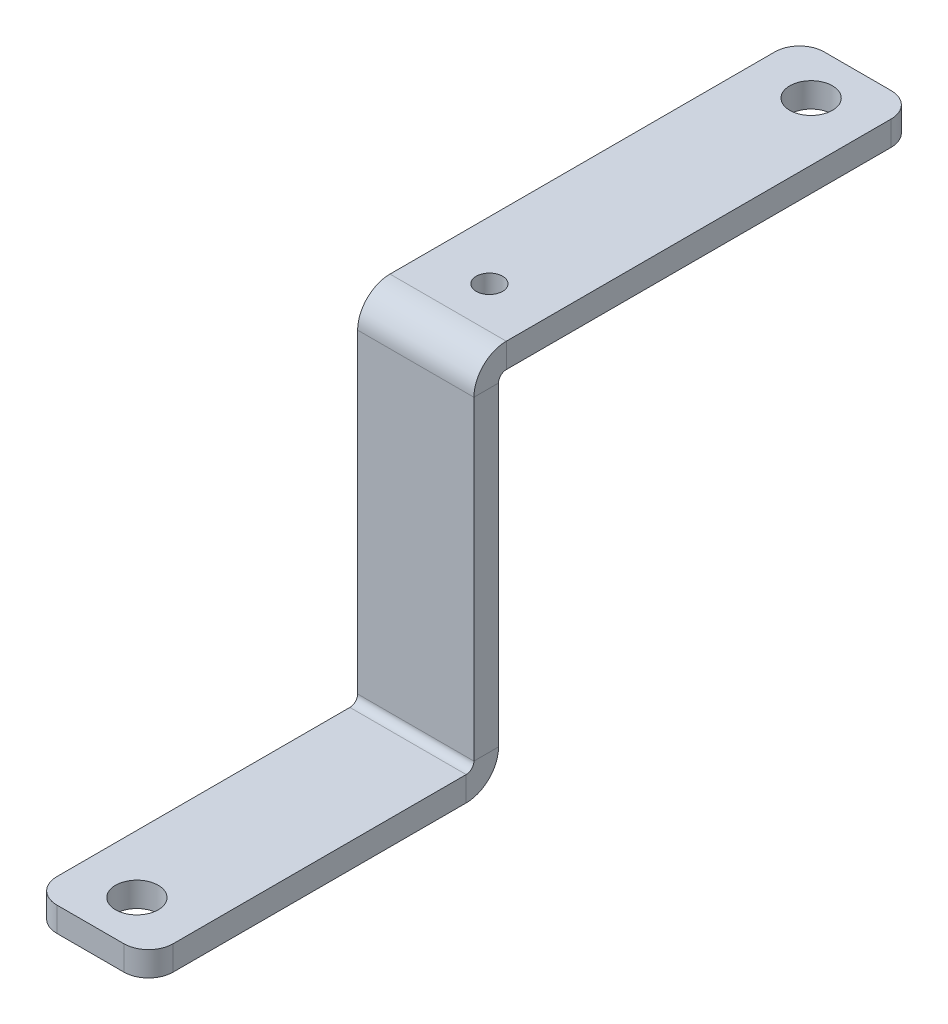
from build123d import *

# Parameters (mm, degrees)
SKETCH1_W                    = 15
SKETCH1_H                    = 45.15
BASE_FLANGE1_DEPTH           = 3.175
EDGE_FLANGE1_STRIP_W         = 14.7
EDGE_FLANGE1_STRIP_H         = 3.175
EDGE_FLANGE1_STRIP_CUT_DEPTH = 15
EDGE_FLANGE1_DEPTH           = 15
EDGE_FLANGE2_STRIP_W         = 14.7
EDGE_FLANGE2_STRIP_H         = 3.175
EDGE_FLANGE2_STRIP_CUT_DEPTH = 15
EDGE_FLANGE2_DEPTH           = 15
M5_CLEARANCE_HOLE2_D         = 5.5
M5_CLEARANCE_HOLE1_D         = 5.5
M3_CLEARANCE_HOLE1_D         = 3.4
FILLET1_R                    = 3.175


# Sheet-metal steps are written as plain solids
with BuildPart() as part:
    # Sketch1 → Base-Flange1 (new body)
    with BuildSketch(Plane(origin=(0, 0, 0), x_dir=(1, 0, 0), z_dir=(0, 1, 0))):
        Rectangle(SKETCH1_W, SKETCH1_H)
    extrude(amount=-BASE_FLANGE1_DEPTH)

    # Edge-Flange1 strip (across the edge) → Edge-Flange1 strip cut (cut)
    with BuildSketch(Plane(origin=(7.5, 0, -22.575), x_dir=(0, 0, 1), z_dir=(-1, 0, 0))):
        with Locations((-3.175, -1.5875)):
            Rectangle(EDGE_FLANGE1_STRIP_W, EDGE_FLANGE1_STRIP_H)
    extrude(amount=EDGE_FLANGE1_STRIP_CUT_DEPTH, mode=Mode.SUBTRACT)

    # Edge-Flange1 section (across the edge) → Edge-Flange1 (add)
    with BuildSketch(Plane(origin=(7.5, 0, -22.575), x_dir=(0, 0, 1), z_dir=(-1, 0, 0))):
        with BuildLine():
            Line((0, 1), (0, 45.825))
            Line((0, 45.825), (3.175, 45.825))
            Line((3.175, 45.825), (3.175, 1))
            ThreePointArc((3.175, 1), (3.467893219, 0.292893219), (4.175, 0))
            Line((4.175, 0), (4.175, -3.175))
            ThreePointArc((4.175, -3.175), (1.222829189, -1.952170811), (0, 1))
        make_face()
    extrude(amount=EDGE_FLANGE1_DEPTH)

    # Edge-Flange2 strip (across the edge) → Edge-Flange2 strip cut (cut)
    with BuildSketch(Plane(origin=(-7.5, 45.825, -22.575), x_dir=(0, -1, 0), z_dir=(1, 0, 0))):
        with Locations((-3.175, -1.5875)):
            Rectangle(EDGE_FLANGE2_STRIP_W, EDGE_FLANGE2_STRIP_H)
    extrude(amount=EDGE_FLANGE2_STRIP_CUT_DEPTH, mode=Mode.SUBTRACT)

    # Edge-Flange2 section (across the edge) → Edge-Flange2 (add)
    with BuildSketch(Plane(origin=(-7.5, 45.825, -22.575), x_dir=(0, -1, 0), z_dir=(1, 0, 0))):
        with BuildLine():
            Line((0, 1), (0, 53.825))
            Line((0, 53.825), (3.175, 53.825))
            Line((3.175, 53.825), (3.175, 1))
            ThreePointArc((3.175, 1), (3.467893219, 0.292893219), (4.175, 0))
            Line((4.175, 0), (4.175, -3.175))
            ThreePointArc((4.175, -3.175), (1.222829189, -1.952170811), (0, 1))
        make_face()
    extrude(amount=EDGE_FLANGE2_DEPTH)

    # M5 Clearance Hole2 (through all)
    with Locations(Plane(origin=(0, 0, 0), x_dir=(1, 0, 0), z_dir=(0, 1, 0))):
        with Locations((0, -16.575)):
            Hole(M5_CLEARANCE_HOLE2_D / 2)

    # M5 Clearance Hole1 (through all)
    with Locations(Plane(origin=(0, 45.825, 0), x_dir=(1, 0, 0), z_dir=(0, 1, 0))):
        with Locations((0, 70.4)):
            Hole(M5_CLEARANCE_HOLE1_D / 2)

    # M3 Clearance Hole1 (through all)
    with Locations(Plane(origin=(0, 45.825, 0), x_dir=(1, 0, 0), z_dir=(0, 1, 0))):
        with Locations((0, 28.9)):
            Hole(M3_CLEARANCE_HOLE1_D / 2)

    # Fillet1
    fillet1_edges = [part.edges().sort_by_distance(p)[0] for p in [
        (-7.5, 44.2375, -76.4),
        (7.5, 44.2375, -76.4),
        (7.5, -1.5875, 22.575),
        (-7.5, -1.5875, 22.575),
    ]]
    fillet(fillet1_edges, radius=FILLET1_R)


solid = part.part
